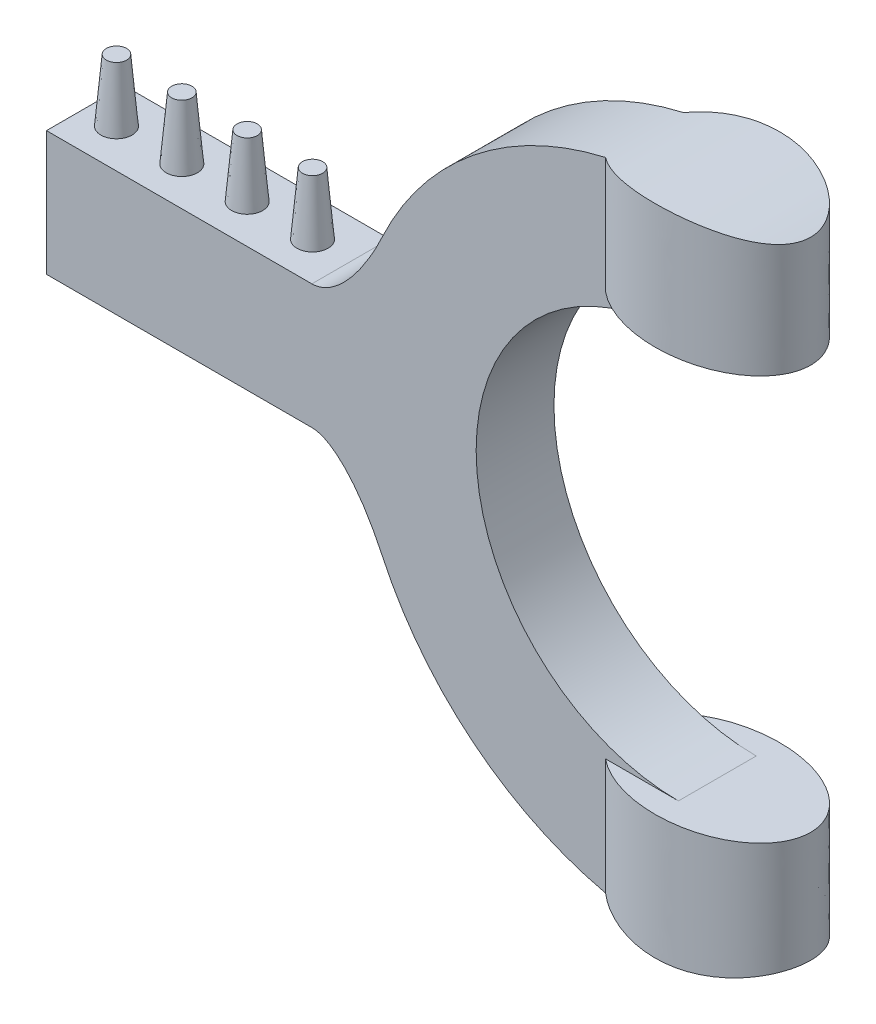
from build123d import *

# Parameters (mm, degrees)
BOSS_EXTRUDE1_DEPTH           = 1.25
SKETCH2_R                     = 0.5
BOSS_EXTRUDE2_DEPTH           = 2
BOSS_EXTRUDE2_DRAFT           = 5
BOSS_EXTRUDE2_PROFILE_2_DEPTH = 2
BOSS_EXTRUDE2_PROFILE_2_DRAFT = 5
BOSS_EXTRUDE2_PROFILE_3_DEPTH = 2
BOSS_EXTRUDE2_PROFILE_3_DRAFT = 5
BOSS_EXTRUDE2_PROFILE_4_DEPTH = 2
BOSS_EXTRUDE2_PROFILE_4_DRAFT = 5
BOSS_EXTRUDE3_REACH           = 28.514
BOSS_EXTRUDE3_END_RADIUS      = 10.5
SKETCH5_RX                    = 3
SKETCH5_RY                    = 2
FILLET1_START                 = -1.25
FILLET1_DEPTH                 = 2.5


with BuildPart() as part:
    # Sketch1 → Boss-Extrude1 (new, symmetric)
    with BuildSketch(Plane.XY):
        with BuildLine():
            Line((-10.307764064, 2), (-20.307764064, 2))
            Line((-20.307764064, 2), (-20.307764064, -2))
            Line((-20.307764064, -2), (-10.307764064, -2))
            ThreePointArc((-10.307764064, -2), (-10.5, 0), (-10.307764064, 2))
        make_face()
        with BuildLine():
            Line((1.74e-07, 10.5), (1.74e-07, 6.5))
            ThreePointArc((1.74e-07, 6.5), (-6.5, 0), (1.74e-07, -6.5))
            Line((1.74e-07, -6.5), (1.74e-07, -10.5))
            ThreePointArc((1.74e-07, -10.5), (-10.5, 0), (1.74e-07, 10.5))
        make_face()
        with BuildLine():
            ThreePointArc((1.74e-07, 10.5), (-0.626113962, 10.481315819), (-1.249999826, 10.425329752))
            Line((-1.249999826, 10.425329752), (-1.249999826, 6.5))
            Line((-1.249999826, 6.5), (1.74e-07, 6.5))
            Line((1.74e-07, 6.5), (1.74e-07, 10.5))
        make_face()
        with BuildLine():
            Line((-1.249999826, -6.5), (-1.249999826, -10.425329752))
            ThreePointArc((-1.249999826, -10.425329752), (-0.626113962, -10.481315819), (1.74e-07, -10.5))
            Line((1.74e-07, -10.5), (1.74e-07, -6.5))
            Line((1.74e-07, -6.5), (-1.249999826, -6.5))
        make_face()
    extrude(amount=BOSS_EXTRUDE1_DEPTH, both=True)


with BuildPart() as boss_extrude2_tool:
    # Sketch2 → Boss-Extrude2 (with draft: the straight prism first)
    with BuildSketch(Plane(origin=(0, 2, 0), x_dir=(1, 0, 0), z_dir=(0, 1, 0))):
        with Locations((-19.307764064, 0)):
            Circle(SKETCH2_R)
    extrude(amount=BOSS_EXTRUDE2_DEPTH)
    # Boss-Extrude2: the draft: its side faces are tilted about the plane it starts from
    boss_extrude2_sides = [boss_extrude2_tool.faces().sort_by_distance(p)[0] for p in [
        (-19.807764064, 3, 0),
    ]]
    draft(boss_extrude2_sides, Plane(origin=(0, 2, 0), x_dir=(1, 0, 0), z_dir=(0, 1, 0)), BOSS_EXTRUDE2_DRAFT)


with BuildPart() as part_1:
    add(part.part)

    # Boss-Extrude2: add boss_extrude2_tool
    add(boss_extrude2_tool.part)


with BuildPart() as boss_extrude2_profile_2_tool:
    # Sketch2 → Boss-Extrude2 profile 2 (with draft: the straight prism first)
    with BuildSketch(Plane(origin=(0, 2, 0), x_dir=(1, 0, 0), z_dir=(0, 1, 0))):
        with Locations((-17.207764064, 0)):
            Circle(SKETCH2_R)
    extrude(amount=BOSS_EXTRUDE2_PROFILE_2_DEPTH)
    # Boss-Extrude2 profile 2: the draft: its side faces are tilted about the plane it starts from
    boss_extrude2_profile_2_sides = [boss_extrude2_profile_2_tool.faces().sort_by_distance(p)[0] for p in [
        (-17.707764064, 3, 0),
    ]]
    draft(boss_extrude2_profile_2_sides, Plane(origin=(0, 2, 0), x_dir=(1, 0, 0), z_dir=(0, 1, 0)), BOSS_EXTRUDE2_PROFILE_2_DRAFT)


with BuildPart() as part_2:
    add(part_1.part)

    # Boss-Extrude2 profile 2: add boss_extrude2_profile_2_tool
    add(boss_extrude2_profile_2_tool.part)


with BuildPart() as boss_extrude2_profile_3_tool:
    # Sketch2 → Boss-Extrude2 profile 3 (with draft: the straight prism first)
    with BuildSketch(Plane(origin=(0, 2, 0), x_dir=(1, 0, 0), z_dir=(0, 1, 0))):
        with Locations((-15.107764064, 0)):
            Circle(SKETCH2_R)
    extrude(amount=BOSS_EXTRUDE2_PROFILE_3_DEPTH)
    # Boss-Extrude2 profile 3: the draft: its side faces are tilted about the plane it starts from
    boss_extrude2_profile_3_sides = [boss_extrude2_profile_3_tool.faces().sort_by_distance(p)[0] for p in [
        (-15.607764064, 3, 0),
    ]]
    draft(boss_extrude2_profile_3_sides, Plane(origin=(0, 2, 0), x_dir=(1, 0, 0), z_dir=(0, 1, 0)), BOSS_EXTRUDE2_PROFILE_3_DRAFT)


with BuildPart() as part_3:
    add(part_2.part)

    # Boss-Extrude2 profile 3: add boss_extrude2_profile_3_tool
    add(boss_extrude2_profile_3_tool.part)


with BuildPart() as boss_extrude2_profile_4_tool:
    # Sketch2 → Boss-Extrude2 profile 4 (with draft: the straight prism first)
    with BuildSketch(Plane(origin=(0, 2, 0), x_dir=(1, 0, 0), z_dir=(0, 1, 0))):
        with Locations((-13.007764064, 0)):
            Circle(SKETCH2_R)
    extrude(amount=BOSS_EXTRUDE2_PROFILE_4_DEPTH)
    # Boss-Extrude2 profile 4: the draft: its side faces are tilted about the plane it starts from
    boss_extrude2_profile_4_sides = [boss_extrude2_profile_4_tool.faces().sort_by_distance(p)[0] for p in [
        (-13.507764064, 3, 0),
    ]]
    draft(boss_extrude2_profile_4_sides, Plane(origin=(0, 2, 0), x_dir=(1, 0, 0), z_dir=(0, 1, 0)), BOSS_EXTRUDE2_PROFILE_4_DRAFT)


with BuildPart() as part_4:
    add(part_3.part)

    # Boss-Extrude2 profile 4: add boss_extrude2_profile_4_tool
    add(boss_extrude2_profile_4_tool.part)

    # Boss-Extrude3: up to this cylinder (the profile starts inside it)
    boss_extrude3_end = Plane(origin=(0, 0, 0), z_dir=(0, 0, -1)) * Cylinder(BOSS_EXTRUDE3_END_RADIUS, 79.028, mode=Mode.PRIVATE)
    # Sketch5 → Boss-Extrude3 (add, up to the surface)
    with BuildSketch(Plane(origin=(0, 6.5, 0), x_dir=(1, 0, 0), z_dir=(0, 1, 0)), mode=Mode.PRIVATE) as boss_extrude3_sk1:
        with Locations((0, 0)):
            Ellipse(SKETCH5_RX, SKETCH5_RY)
    boss_extrude3_tool1 = extrude(boss_extrude3_sk1.sketch, amount=BOSS_EXTRUDE3_REACH, mode=Mode.PRIVATE) & boss_extrude3_end
    boss_extrude3 = boss_extrude3_tool1.solids().sort_by_distance((0, 6.5, 0))[0]
    add(boss_extrude3)

    # Mirror1: Boss-Extrude3 across plane
    add(boss_extrude3.mirror(Plane.ZX))

    # Fillet1: read off the stored shape, not the designer's step
    # Fillet1 outline → Fillet1 (add)
    with BuildSketch(Plane.XY.offset(FILLET1_START)):
        with BuildLine():
            add(Edge.make_bspline(
                [(-11.779218989, 2), (-10.654356635, 2), (-9.513984568, 4.442307692)],
                knots=[0, 0, 0, 1, 1, 1], degree=2, weights=[1, 0.843527392, 1]))
            Line((-11.779218989, 2), (-10.307764064, 2))
            ThreePointArc((-10.307764064, 2), (-9.985822271, 3.245512837), (-9.513984568, 4.442307692))
        make_face()
        with BuildLine():
            add(Edge.make_bspline(
                [(-9.513984568, -4.442307692), (-10.654356635, -2), (-11.779218989, -2)],
                knots=[0, 0, 0, 1, 1, 1], degree=2, weights=[1, 0.843527392, 1]))
            ThreePointArc((-9.513984568, -4.442307692), (-9.985822271, -3.245512837), (-10.307764064, -2))
            Line((-10.307764064, -2), (-11.779218989, -2))
        make_face()
    extrude(amount=FILLET1_DEPTH)


solid = part_4.part
